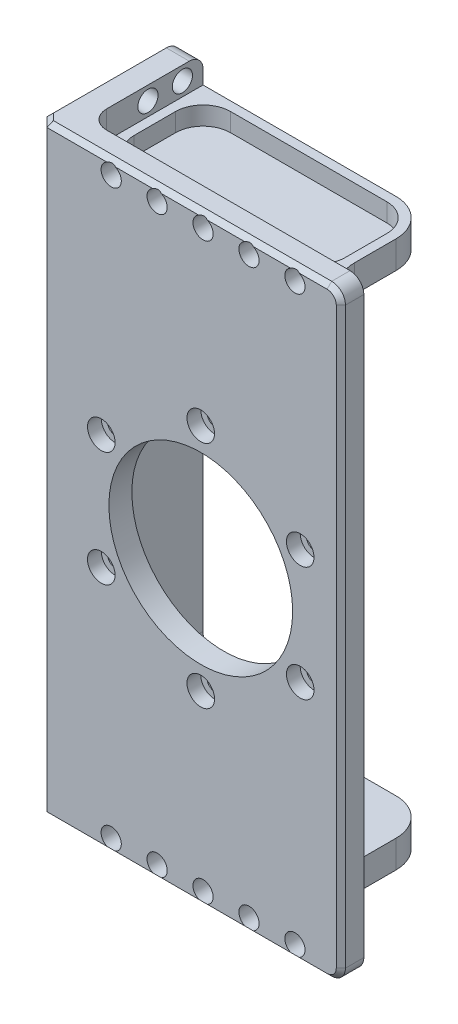
from build123d import *

# Parameters (mm, degrees)
SKETCH_1_W          = 60
SKETCH_1_H          = 131
EXTRUDE_1_DEPTH     = 5
SKETCH_2_W          = 30
SKETCH_2_H          = 131
EXTRUDE_2_DEPTH     = 6
SKETCH_3_R          = 20
CUT_EXTRUDE_1_DEPTH = 10
CHAMFER_1_SIZE      = 2
FILLET_1_R          = 3
SKETCH_13_R         = 1.6
CUT_EXTRUDE_2_DEPTH = 6
SKETCH_14_R         = 3
CUT_EXTRUDE_3_DEPTH = 3
CHAMFER_4_SIZE      = 1
SKETCH_16_W         = 50
SKETCH_16_H         = 6
EXTRUDE_4_DEPTH     = 25
FILLET_3_R          = 4
FILLET_4_R          = 10
FILLET_5_R          = 8
CUT_EXTRUDE_4_DEPTH = 4
FILLET_6_R          = 6
SKETCH_19_R         = 2.2
CUT_EXTRUDE_5_DEPTH = 18
SKETCH_20_R         = 2.2
CUT_EXTRUDE_6_DEPTH = 18


with BuildPart() as part:
    # 草图1 → 凸台-拉伸1 (new body)
    with BuildSketch(Plane.XY):
        with Locations((-207.175860782, 60.5)):
            Rectangle(SKETCH_1_W, SKETCH_1_H)
    extrude(amount=EXTRUDE_1_DEPTH)

    # 草图2 → 凸台-拉伸2 (add)
    with BuildSketch(Plane.ZY.offset(237.175860782)):
        with Locations((-10, 60.5)):
            Rectangle(SKETCH_2_W, SKETCH_2_H)
    extrude(amount=EXTRUDE_2_DEPTH)

    # 草图3 → 切除-拉伸1 (cut)
    with BuildSketch(Plane.XY.offset(5)):
        with Locations((-207.675860782, 60.5)):
            Circle(SKETCH_3_R)
    extrude(amount=-CUT_EXTRUDE_1_DEPTH, mode=Mode.SUBTRACT)

    # 倒角1
    chamfer_1_edges = [part.edges().sort_by_distance(p)[0] for p in [
        (-243.175860782, 60.5, 5),
    ]]
    chamfer(chamfer_1_edges, length=CHAMFER_1_SIZE)

    # 圆角1
    fillet_1_edges = [part.edges().sort_by_distance(p)[0] for p in [
        (-240.175860782, 126, -25),
        (-240.175860782, -5, -25),
        (-177.175860782, 126, 2.5),
        (-177.175860782, -5, 2.5),
    ]]
    fillet(fillet_1_edges, radius=FILLET_1_R)

    # 草图13 → 切除-拉伸2 (cut)
    with BuildSketch(Plane.XY.offset(5)):
        with Locations((-207.675860782, 85.5)):
            Circle(SKETCH_13_R)
        with Locations((-229.326495877, 73)):
            Circle(SKETCH_13_R)
        with Locations((-186.025225688, 73)):
            Circle(SKETCH_13_R)
        with Locations((-186.025225688, 48)):
            Circle(SKETCH_13_R)
        with Locations((-207.675860782, 35.5)):
            Circle(SKETCH_13_R)
        with Locations((-229.326495877, 48)):
            Circle(SKETCH_13_R)
    extrude(amount=-CUT_EXTRUDE_2_DEPTH, mode=Mode.SUBTRACT)

    # 草图14 → 切除-拉伸3 (cut)
    with BuildSketch(Plane.XY.offset(5)):
        with Locations((-207.675860782, 85.5)):
            Circle(SKETCH_14_R)
        with Locations((-186.025225688, 73)):
            Circle(SKETCH_14_R)
        with Locations((-186.025225688, 48)):
            Circle(SKETCH_14_R)
        with Locations((-207.675860782, 35.5)):
            Circle(SKETCH_14_R)
        with Locations((-229.326495877, 48)):
            Circle(SKETCH_14_R)
        with Locations((-229.326495877, 73)):
            Circle(SKETCH_14_R)
    extrude(amount=-CUT_EXTRUDE_3_DEPTH, mode=Mode.SUBTRACT)

    # 倒角4
    chamfer_4_edges = [part.edges().sort_by_distance(p)[0] for p in [
        (-243.175860782, 126, -9.5),
        (-242.175860782, 126, 4),
        (-210.675860782, -5, 5),
        (-242.175860782, -5, 4),
        (-243.175860782, 60.5, -25),
        (-210.675860782, 126, 5),
        (-243.175860782, -5, -9.5),
        (-243.175860782, -4.121320344, -24.121320344),
        (-243.175860782, 125.121320344, -24.121320344),
        (-177.175860782, 60.5, 5),
        (-178.054540439, -4.121320344, 5),
        (-178.054540439, 125.121320344, 5),
    ]]
    chamfer(chamfer_4_edges, length=CHAMFER_4_SIZE)

    # 草图16 → 凸台-拉伸4 (add)
    with BuildSketch(Plane(origin=(0, 0, 0), x_dir=(-1, 0, 0), z_dir=(0, 0, -1))):
        with Locations((212.175860782, 117)):
            Rectangle(SKETCH_16_W, SKETCH_16_H)
    extrude_4 = extrude(amount=EXTRUDE_4_DEPTH)

    # 镜向1: 凸台-拉伸4 across plane
    add(extrude_4.mirror(Plane(origin=(0, 60.5, 0), x_dir=(0, 0, 1), z_dir=(0, -1, 0))))

    # 圆角3
    fillet_3_edges = [part.edges().sort_by_distance(p)[0] for p in [
        (-237.175860782, -2, 0),
        (-237.175860782, 123, 0),
    ]]
    fillet(fillet_3_edges, radius=FILLET_3_R)

    # 圆角4
    fillet_4_edges = [part.edges().sort_by_distance(p)[0] for p in [
        (-237.175860782, 114, -12.5),
        (-237.175860782, 7, -12.5),
    ]]
    fillet(fillet_4_edges, radius=FILLET_4_R)

    # 圆角5
    fillet_5_edges = [part.edges().sort_by_distance(p)[0] for p in [
        (-187.175860782, 117, -25),
        (-187.175860782, 117, 0),
        (-187.175860782, 4, 0),
        (-187.175860782, 4, -25),
    ]]
    fillet(fillet_5_edges, radius=FILLET_5_R)

    # 草图17 → 切除-拉伸4 (cut)
    with BuildSketch(Plane(origin=(0, 120, 0), x_dir=(1, 0, 0), z_dir=(0, 1, 0))):
        with BuildLine():
            Line((-235.175860782, 4), (-235.175860782, 2))
            Line((-235.175860782, 2), (-233.175860782, 2))
            Line((-233.175860782, 2), (-187.175860782, 2))
            ThreePointArc((-187.175860782, 2), (-188.662693763, 4.83772234), (-189.175860782, 8))
            Line((-189.175860782, 8), (-189.175860782, 17))
            ThreePointArc((-189.175860782, 17), (-190.933220095, 21.242640687), (-195.175860782, 23))
            Line((-195.175860782, 23), (-235.175860782, 23))
            Line((-235.175860782, 23), (-235.175860782, 4))
        make_face()
    cut_extrude_4 = extrude(amount=-CUT_EXTRUDE_4_DEPTH, mode=Mode.SUBTRACT)

    # 镜向2: 切除-拉伸4 across plane
    add(cut_extrude_4.mirror(Plane(origin=(0, 60.5, 0), x_dir=(0, 0, 1), z_dir=(0, -1, 0))), mode=Mode.SUBTRACT)

    # 圆角6
    fillet_6_edges = [part.edges().sort_by_distance(p)[0] for p in [
        (-187.175860782, 118, -2),
        (-235.175860782, 118, -23),
        (-235.175860782, 118, -2),
        (-235.175860782, 3, -23),
        (-187.175860782, 3, -2),
        (-235.175860782, 3, -2),
    ]]
    fillet(fillet_6_edges, radius=FILLET_6_R - 0.0001)  # a hair under: the kernel refuses the full size

    # 草图19 → 切除-拉伸5 (cut)
    with BuildSketch(Plane.XY.offset(5)):
        with Locations((-217.175860782, -2)):
            Circle(SKETCH_19_R)
        with Locations((-187.175860782, -2)):
            Circle(SKETCH_19_R)
        with Locations((-197.175860782, -2)):
            Circle(SKETCH_19_R)
        with Locations((-207.175860782, -2)):
            Circle(SKETCH_19_R)
        with Locations((-227.175860782, -2)):
            Circle(SKETCH_19_R)
    cut_extrude_5 = extrude(amount=-CUT_EXTRUDE_5_DEPTH, mode=Mode.SUBTRACT)

    # 镜向3: 切除-拉伸5 across plane
    add(cut_extrude_5.mirror(Plane(origin=(0, 60.5, 0), x_dir=(0, 0, 1), z_dir=(0, -1, 0))), mode=Mode.SUBTRACT)

    # 草图20 → 切除-拉伸6 (cut)
    with BuildSketch(Plane.ZY.offset(243.175860782)):
        with Locations((-20.5, -2)):
            Circle(SKETCH_20_R)
        with Locations((-13, -2)):
            Circle(SKETCH_20_R)
    cut_extrude_6 = extrude(amount=-CUT_EXTRUDE_6_DEPTH, mode=Mode.SUBTRACT)

    # 镜向4: 切除-拉伸6 across plane
    add(cut_extrude_6.mirror(Plane(origin=(0, 60.5, 0), x_dir=(0, 0, 1), z_dir=(0, -1, 0))), mode=Mode.SUBTRACT)


solid = part.part
